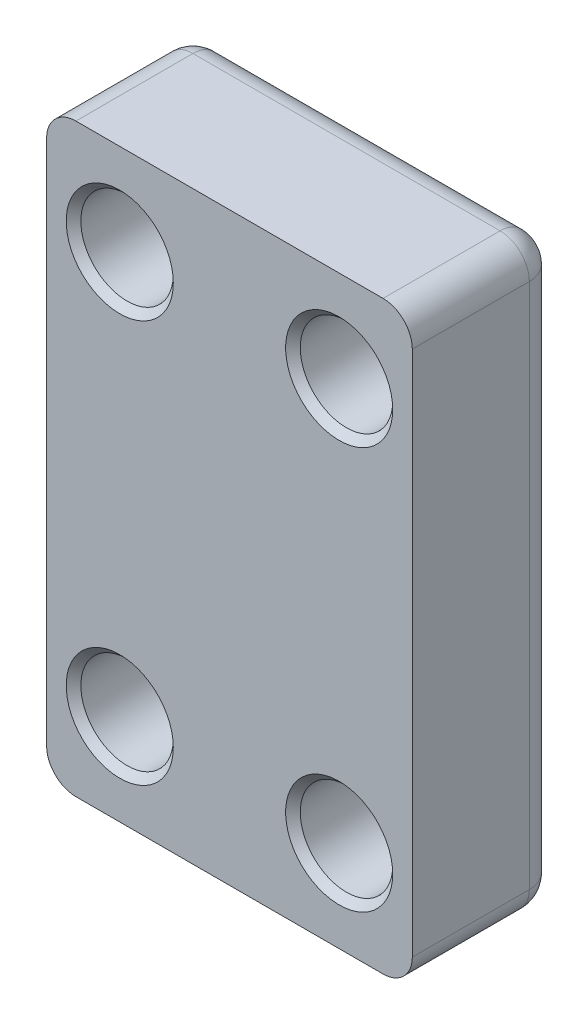
from build123d import *

# Parameters (mm, degrees)
SKETCH1_W                          = 31.75
SKETCH1_H                          = 50.8
BOSS_EXTRUDE1_DEPTH                = 12.7
O_0_316_DIAMETER_HOLE1_D           = 8.0264
O_0_316_DIAMETER_HOLE1_CSINK_D     = 9.2964
O_0_316_DIAMETER_HOLE1_CSINK_ANGLE = 90
FILLET1_R                          = 2.54


with BuildPart() as part:
    # Sketch1 → Boss-Extrude1 (new body)
    with BuildSketch(Plane.XY):
        Rectangle(SKETCH1_W, SKETCH1_H)
    extrude(amount=BOSS_EXTRUDE1_DEPTH)

    # O (0.316) Diameter Hole1 (through all)
    with Locations(Plane.XY.offset(12.7)):
        with Locations((-9.525, 17.4625), (9.525, 17.4625), (9.525, -17.4625), (-9.525, -17.4625)):
            CounterSinkHole(O_0_316_DIAMETER_HOLE1_D / 2, O_0_316_DIAMETER_HOLE1_CSINK_D / 2, counter_sink_angle=O_0_316_DIAMETER_HOLE1_CSINK_ANGLE)

    # Fillet1
    # the kernel refuses this fillet: 2.54 mm, written as the material it takes off along each edge
    with BuildSketch(Plane(origin=(13.335, -22.86, 2.54), x_dir=(0, 0, -1), z_dir=(0, -1, 0))) as fillet1_piece_1_section:
        Polygon((0, 0), (FILLET1_R, 0), (FILLET1_R, FILLET1_R), (0, FILLET1_R), align=None)
    fillet1_piece_1 = extrude(amount=FILLET1_R, mode=Mode.PRIVATE)
    fillet1_piece_1 = fillet1_piece_1 - Plane(origin=(13.335, -22.86, 2.54), x_dir=(-0.7071067811865475, 0, 0.7071067811865475), z_dir=(0, -1, 0)) * Sphere(FILLET1_R, mode=Mode.PRIVATE)
    add(fillet1_piece_1, mode=Mode.SUBTRACT)
    with BuildSketch(Plane(origin=(-13.335, -22.86, 2.54), x_dir=(0, 0, -1), z_dir=(0, -1, 0))) as fillet1_piece_2_section:
        Polygon((0, 0), (FILLET1_R, 0), (FILLET1_R, -FILLET1_R), (0, -FILLET1_R), align=None)
    fillet1_piece_2 = extrude(amount=FILLET1_R, mode=Mode.PRIVATE)
    fillet1_piece_2 = fillet1_piece_2 - Plane(origin=(-13.335, -22.86, 2.54), x_dir=(0.7071067811865475, 0, 0.7071067811865475), z_dir=(0, -1, 0)) * Sphere(FILLET1_R, mode=Mode.PRIVATE)
    add(fillet1_piece_2, mode=Mode.SUBTRACT)
    with BuildSketch(Plane(origin=(-13.335, 22.86, 2.54), x_dir=(0, 0, -1), z_dir=(0, 1, 0))) as fillet1_piece_3_section:
        Polygon((0, 0), (FILLET1_R, 0), (FILLET1_R, FILLET1_R), (0, FILLET1_R), align=None)
    fillet1_piece_3 = extrude(amount=FILLET1_R, mode=Mode.PRIVATE)
    fillet1_piece_3 = fillet1_piece_3 - Plane(origin=(-13.335, 22.86, 2.54), x_dir=(0.7071067811865475, 0, 0.7071067811865475), z_dir=(0, 1, 0)) * Sphere(FILLET1_R, mode=Mode.PRIVATE)
    add(fillet1_piece_3, mode=Mode.SUBTRACT)
    with BuildSketch(Plane(origin=(13.335, 22.86, 2.54), x_dir=(0, 0, -1), z_dir=(0, 1, 0))) as fillet1_piece_4_section:
        Polygon((0, 0), (FILLET1_R, 0), (FILLET1_R, -FILLET1_R), (0, -FILLET1_R), align=None)
    fillet1_piece_4 = extrude(amount=FILLET1_R, mode=Mode.PRIVATE)
    fillet1_piece_4 = fillet1_piece_4 - Plane(origin=(13.335, 22.86, 2.54), x_dir=(-0.7071067811865475, 0, 0.7071067811865475), z_dir=(0, 1, 0)) * Sphere(FILLET1_R, mode=Mode.PRIVATE)
    add(fillet1_piece_4, mode=Mode.SUBTRACT)
    with BuildSketch(Plane(origin=(-9.525, -17.4625, 0), x_dir=(-1, 0, 0), z_dir=(0, -1, 0))) as fillet1_piece_5:
        with BuildLine():
            CenterArc((4.0132 + FILLET1_R, -FILLET1_R), FILLET1_R, 90, 90)
            Line((4.0132 + FILLET1_R, 0), (4.0132, 0))
            Line((4.0132, 0), (4.0132, -FILLET1_R))
        make_face()
    revolve(axis=Axis((-9.525, -17.4625, 0), (0, 0, -1)), mode=Mode.SUBTRACT)
    with BuildSketch(Plane(origin=(9.525, -17.4625, 0), x_dir=(-1, 0, 0), z_dir=(0, -1, 0))) as fillet1_piece_6:
        with BuildLine():
            CenterArc((4.0132 + FILLET1_R, -FILLET1_R), FILLET1_R, 90, 90)
            Line((4.0132 + FILLET1_R, 0), (4.0132, 0))
            Line((4.0132, 0), (4.0132, -FILLET1_R))
        make_face()
    revolve(axis=Axis((9.525, -17.4625, 0), (0, 0, -1)), mode=Mode.SUBTRACT)
    with BuildSketch(Plane(origin=(9.525, 17.4625, 0), x_dir=(-1, 0, 0), z_dir=(0, -1, 0))) as fillet1_piece_7:
        with BuildLine():
            CenterArc((4.0132 + FILLET1_R, -FILLET1_R), FILLET1_R, 90, 90)
            Line((4.0132 + FILLET1_R, 0), (4.0132, 0))
            Line((4.0132, 0), (4.0132, -FILLET1_R))
        make_face()
    revolve(axis=Axis((9.525, 17.4625, 0), (0, 0, -1)), mode=Mode.SUBTRACT)
    with BuildSketch(Plane(origin=(-9.525, 17.4625, 0), x_dir=(-1, 0, 0), z_dir=(0, -1, 0))) as fillet1_piece_8:
        with BuildLine():
            CenterArc((4.0132 + FILLET1_R, -FILLET1_R), FILLET1_R, 90, 90)
            Line((4.0132 + FILLET1_R, 0), (4.0132, 0))
            Line((4.0132, 0), (4.0132, -FILLET1_R))
        make_face()
    revolve(axis=Axis((-9.525, 17.4625, 0), (0, 0, -1)), mode=Mode.SUBTRACT)
    with BuildSketch(Plane(origin=(13.335, -25.4, 0), x_dir=(0, 0, 1), z_dir=(-1, 0, 0)), Plane(origin=(-13.335, 25.4, 0), x_dir=(0, 0, 1), z_dir=(1, 0, 0))) as fillet1_piece_9:
        with BuildLine():
            CenterArc((FILLET1_R, FILLET1_R), FILLET1_R, 180, 90)
            Line((0, FILLET1_R), (0, 0))
            Line((0, 0), (FILLET1_R, 0))
        make_face()
    extrude(amount=26.67, mode=Mode.SUBTRACT)
    with BuildSketch(Plane(origin=(-15.875, -22.86, 0), x_dir=(1, 0, 0), z_dir=(0, 1, 0)), Plane(origin=(15.875, 22.86, 0), x_dir=(-1, 0, 0), z_dir=(0, -1, 0))) as fillet1_piece_10:
        with BuildLine():
            CenterArc((FILLET1_R, -FILLET1_R), FILLET1_R, 90, 90)
            Line((0, -FILLET1_R), (0, 0))
            Line((0, 0), (FILLET1_R, 0))
        make_face()
    extrude(amount=45.72, mode=Mode.SUBTRACT)
    with BuildSketch(Plane(origin=(15.875, -25.4, 2.54), x_dir=(-1, 0, 0), z_dir=(0, 0, 1)), Plane(origin=(-15.875, 25.4, 2.54), x_dir=(1, 0, 0), z_dir=(0, 0, 1))) as fillet1_piece_11:
        with BuildLine():
            CenterArc((FILLET1_R, -FILLET1_R), FILLET1_R, 90, 90)
            Line((0, -FILLET1_R), (0, 0))
            Line((0, 0), (FILLET1_R, 0))
        make_face()
    extrude(amount=16.51, mode=Mode.SUBTRACT)
    with BuildSketch(Plane(origin=(-15.875, -25.4, 2.54), x_dir=(1, 0, 0), z_dir=(0, 0, 1)), Plane(origin=(15.875, 25.4, 2.54), x_dir=(-1, 0, 0), z_dir=(0, 0, 1))) as fillet1_piece_12:
        with BuildLine():
            CenterArc((FILLET1_R, FILLET1_R), FILLET1_R, 180, 90)
            Line((0, FILLET1_R), (0, 0))
            Line((0, 0), (FILLET1_R, 0))
        make_face()
    extrude(amount=16.51, mode=Mode.SUBTRACT)


solid = part.part
